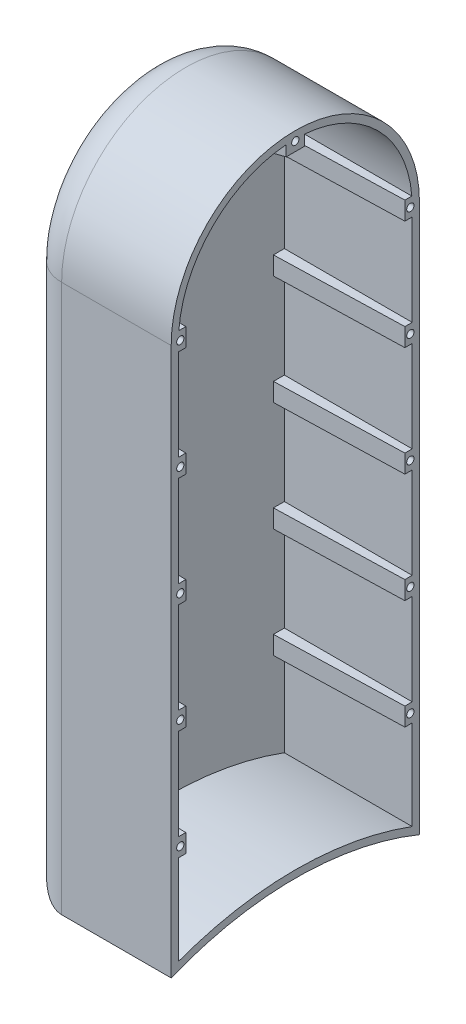
from build123d import *

# Parameters (mm, degrees)
BOSS_EXTRUDE3_DEPTH  = 5
EXTRUDE_THIN3_DEPTH  = 35
RIB3_START           = -2.5
RIB3_DEPTH           = 5
RIB13_START          = -2.5
RIB13_DEPTH          = 5
LPATTERN1_COUNT      = 5
LPATTERN1_PITCH      = 30
MIRROR1_START        = -2.5
MIRROR1_COPY_1_DEPTH = 5
MIRROR1_COPY_2_DEPTH = 5
MIRROR1_COPY_3_DEPTH = 5
MIRROR1_COPY_4_DEPTH = 5
CUT_EXTRUDE1_START   = -40
SKETCH11_R           = 1
CUT_EXTRUDE1_DEPTH   = 10
FILLET2_R            = 10
SKETCH12_W           = 22
SKETCH12_H           = 1.974358974
CUT_EXTRUDE2_DEPTH   = 3


# Read off the part's stored shape, not the designer's step: Rib3, Rib13
with BuildPart() as part:
    # Sketch7 → Boss-Extrude3 (new body)
    with BuildSketch(Plane(origin=(0, 0, 0), x_dir=(0, 0, -1), z_dir=(1, 0, 0))):
        with BuildLine():
            Line((-34, 0), (-34, -150))
            ThreePointArc((-34, -150), (0, -143.330666624), (34, -150))
            Line((34, -150), (34, 0))
            ThreePointArc((34, 0), (0, 34), (-34, 0))
        make_face()
    extrude(amount=BOSS_EXTRUDE3_DEPTH)

    # Sketch10 → Extrude-Thin3 (add)
    with BuildSketch(Plane(origin=(5, 0, 0), x_dir=(0, 0, -1), z_dir=(1, 0, 0))):
        with BuildLine():
            Line((34, -150), (34, 0))
            ThreePointArc((34, 0), (0, 34), (-34, 0))
            Line((-34, 0), (-34, -150))
            ThreePointArc((-34, -150), (0, -143.330666624), (34, -150))
        make_face()
        with BuildLine():
            Line((32, -147.075232013), (32, 0))
            ThreePointArc((32, 0), (0, 32), (-32, 0))
            Line((-32, 0), (-32, -147.075232013))
            ThreePointArc((-32, -147.075232013), (0, -141.330666624), (32, -147.075232013))
        make_face(mode=Mode.SUBTRACT)
    extrude(amount=EXTRUDE_THIN3_DEPTH)

    # Rib3 outline → Rib3 (add)
    with BuildSketch(Plane.XY.offset(RIB3_START)):
        Polygon((5, 20), (40, 29), (40, 33), (4, 33), (4, 19.742857143), align=None)
    extrude(amount=RIB3_DEPTH)

    # Rib13 outline → Rib13 (add)
    with BuildSketch(Plane(origin=(0, 0, 0), x_dir=(1, 0, 0), z_dir=(0, 1, 0)).offset(RIB13_START)):
        Polygon((5, -32), (40, -32), (40, -30), (5, -29), align=None)
    rib13 = extrude(amount=RIB13_DEPTH)

    # LPattern1: Rib13 ×5
    with Locations(*[(0, -i * LPATTERN1_PITCH, 0) for i in range(1, LPATTERN1_COUNT)]):
        add(rib13)

    # Mirror1: Rib13 across plane
    add(rib13.mirror(Plane.XY))

    # Mirror1 copy 1 sketch → Mirror1 copy 1 (add)
    with BuildSketch(Plane(origin=(0, -30, 0), x_dir=(1, 0, 0), z_dir=(0, 1, 0)).offset(MIRROR1_START)):
        Polygon((5, 32), (40, 32), (40, 30), (5, 29), align=None)
    extrude(amount=MIRROR1_COPY_1_DEPTH)

    # Mirror1 copy 2 sketch → Mirror1 copy 2 (add)
    with BuildSketch(Plane(origin=(0, -60, 0), x_dir=(1, 0, 0), z_dir=(0, 1, 0)).offset(MIRROR1_START)):
        Polygon((5, 32), (40, 32), (40, 30), (5, 29), align=None)
    extrude(amount=MIRROR1_COPY_2_DEPTH)

    # Mirror1 copy 3 sketch → Mirror1 copy 3 (add)
    with BuildSketch(Plane(origin=(0, -90, 0), x_dir=(1, 0, 0), z_dir=(0, 1, 0)).offset(MIRROR1_START)):
        Polygon((5, 32), (40, 32), (40, 30), (5, 29), align=None)
    extrude(amount=MIRROR1_COPY_3_DEPTH)

    # Mirror1 copy 4 sketch → Mirror1 copy 4 (add)
    with BuildSketch(Plane(origin=(0, -120, 0), x_dir=(1, 0, 0), z_dir=(0, 1, 0)).offset(MIRROR1_START)):
        Polygon((5, 32), (40, 32), (40, 30), (5, 29), align=None)
    extrude(amount=MIRROR1_COPY_4_DEPTH)

    # Sketch11 → Cut-Extrude1 (cut)
    with BuildSketch(Plane.ZY.offset(CUT_EXTRUDE1_START)):
        with Locations(Location((-31.5, 0, 0), (0, 0, 180))):
            Circle(SKETCH11_R)
        with Locations(Location((31.5, 0, 0), (0, 0, 180))):
            Circle(SKETCH11_R)
        with Locations(Location((-31.5, -30, 0), (0, 0, 180))):
            Circle(SKETCH11_R)
        with Locations(Location((31.5, -30, 0), (0, 0, 180))):
            Circle(SKETCH11_R)
        with Locations(Location((-31.5, -60, 0), (0, 0, 180))):
            Circle(SKETCH11_R)
        with Locations(Location((31.5, -60, 0), (0, 0, 180))):
            Circle(SKETCH11_R)
        with Locations(Location((-31.5, -90, 0), (0, 0, 180))):
            Circle(SKETCH11_R)
        with Locations(Location((31.5, -90, 0), (0, 0, 180))):
            Circle(SKETCH11_R)
        with Locations(Location((-31.5, -120, 0), (0, 0, 180))):
            Circle(SKETCH11_R)
        with Locations(Location((31.5, -120, 0), (0, 0, 180))):
            Circle(SKETCH11_R)
        with Locations(Location((0, 31.5, 0), (0, 0, 180))):
            Circle(SKETCH11_R)
    extrude(amount=CUT_EXTRUDE1_DEPTH, mode=Mode.SUBTRACT)

    # Fillet2
    fillet2_edges = [part.edges().sort_by_distance(p)[0] for p in [
        (0, -75, -34),
        (0, -143.330666624, 0),
        (0, -75, 34),
        (0, 34, 0),
    ]]
    fillet(fillet2_edges, radius=FILLET2_R)

    # Sketch12 → Cut-Extrude2 (cut)
    # profile 1 of 7: a face of its own
    with BuildSketch(Plane.ZY):
        Polygon((-11, -1.692307692), (11, -4.596554487), (11, -4.878605769), (-7.051282051, -13.961538462), (11, -23.018028846), (11, -23.300080128), (-11, -26.230769231), (-11, -24.256410256), (4.816907051, -22.141025641), (-11, -14.203926282), (-11, -13.754407051), (4.865384615, -5.782051282), (-11, -3.679887821), align=None)
    # profile 2 of 7: a face of its own
    with BuildSketch(Plane.ZY):
        Polygon((11, -39.769230769), (-11, -49.923076923), (-11, -47.776842949), (-3.948717949, -44.524439103), (-3.948717949, -34.551282051), (-11, -31.210737179), (-11, -29.051282051), (11, -39.487179487), align=None)
        Polygon((6.707532051, -39.606169872), (-1.692307692, -35.626602564), (-1.692307692, -43.484375), align=None, mode=Mode.SUBTRACT)
    # profile 3 of 7: a face of its own
    with BuildSketch(Plane.ZY):
        with Locations((0, -54.294871795)):
            Rectangle(SKETCH12_W, SKETCH12_H)
    # profile 4 of 7: a face of its own
    with BuildSketch(Plane.ZY):
        Polygon((11, -68.538461538), (11, -70.512820513), (-8.743589744, -70.512820513), (-8.743589744, -78.974358974), (-11, -78.974358974), (-11, -68.538461538), align=None)
    # profile 5 of 7: a face of its own
    with BuildSketch(Plane.ZY):
        with Locations((0, -83.628205128)):
            Rectangle(SKETCH12_W, SKETCH12_H)
    # profile 6 of 7: a face of its own
    with BuildSketch(Plane.ZY):
        Polygon((-11, -89.41025641), (11, -89.41025641), (11, -89.824519231), (-6.315304487, -104.358974359), (11, -104.358974359), (11, -106.333333333), (-11, -106.333333333), (-11, -105.883814103), (6.275641026, -91.384615385), (-11, -91.384615385), align=None)
    # profile 7 of 7: a face of its own
    with BuildSketch(Plane.ZY):
        Polygon((11, -111.974358974), (11, -113.948717949), (1.974358974, -113.948717949), (1.974358974, -125.230769231), (11, -125.230769231), (11, -127.205128205), (-11, -127.205128205), (-11, -125.230769231), (-0.282051282, -125.230769231), (-0.282051282, -113.948717949), (-11, -113.948717949), (-11, -111.974358974), align=None)
    extrude(amount=-CUT_EXTRUDE2_DEPTH, mode=Mode.SUBTRACT)


solid = part.part
